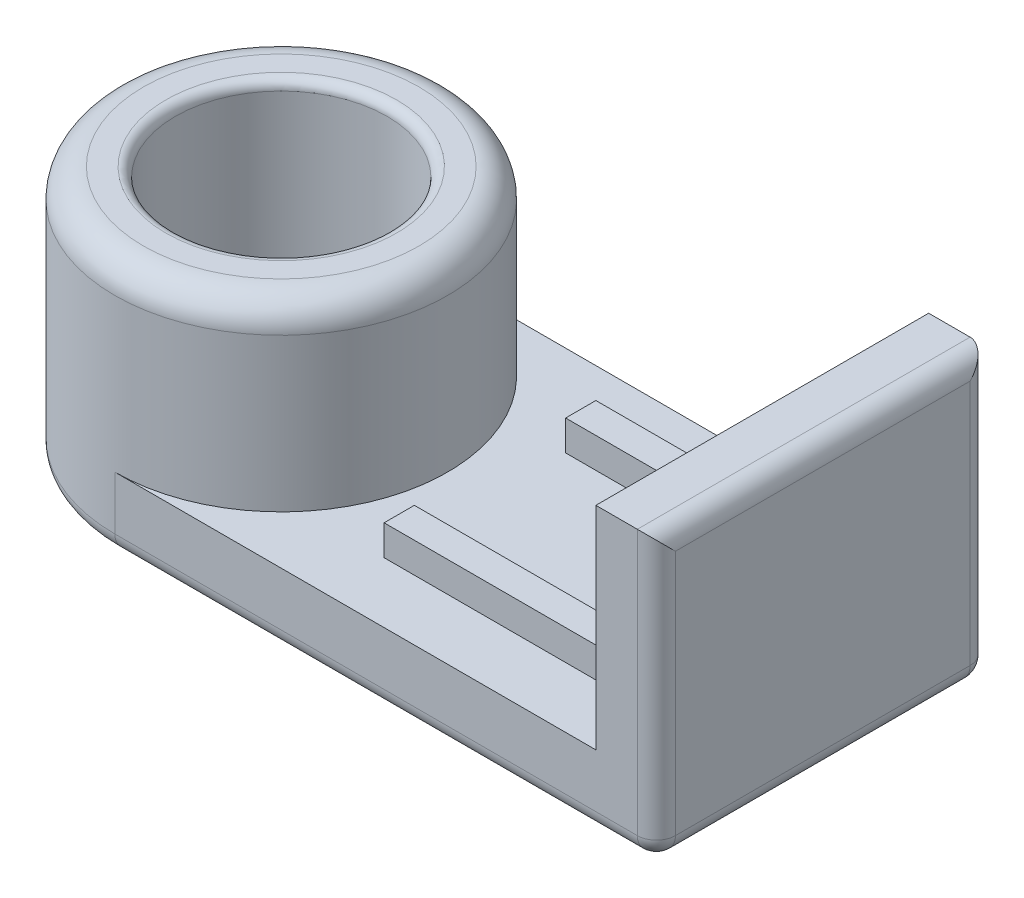
from build123d import *

# Parameters (mm, degrees)
BOSS_EXTRUDE1_DEPTH = 7.62
SKETCH4_W           = 6.35
SKETCH4_H           = 34.925
BOSS_EXTRUDE3_DEPTH = 12.7
SKETCH5_R           = 11.1125
CUT_EXTRUDE1_DEPTH  = 12.7
SKETCH6_W           = 25.4
SKETCH6_H           = 3.175
BOSS_EXTRUDE4_DEPTH = 3.175
SKETCH7_W           = 25.4
SKETCH7_H           = 3.175
BOSS_EXTRUDE5_DEPTH = 3.175
SKETCH10_W          = 6.35
SKETCH10_H          = 34.925
BOSS_EXTRUDE8_DEPTH = 9.525
FILLET1_R           = 2
FILLET2_R           = 2
SKETCH11_R          = 17.4625
BOSS_EXTRUDE9_DEPTH = 19.05
SKETCH12_R          = 11.1125
CUT_EXTRUDE2_DEPTH  = 47.677899348
FILLET3_R           = 1
FILLET4_R           = 3


with BuildPart() as part:
    # Sketch1 → Boss-Extrude1 (new body)
    with BuildSketch(Plane(origin=(0, 0, 0), x_dir=(1, 0, 0), z_dir=(0, 1, 0))):
        with BuildLine():
            Line((37.1475, -17.4625), (37.1475, 17.4625))
            Line((37.1475, 17.4625), (-19.685, 17.4625))
            ThreePointArc((-19.685, 17.4625), (-37.1475, 0), (-19.685, -17.4625))
            Line((-19.685, -17.4625), (37.1475, -17.4625))
        make_face()
    extrude(amount=BOSS_EXTRUDE1_DEPTH)

    # Sketch4 → Boss-Extrude3 (add)
    with BuildSketch(Plane(origin=(0, 7.62, 0), x_dir=(1, 0, 0), z_dir=(0, 1, 0))):
        with Locations((33.9725, 0)):
            Rectangle(SKETCH4_W, SKETCH4_H)
    extrude(amount=BOSS_EXTRUDE3_DEPTH)

    # Sketch5 → Cut-Extrude1 (cut)
    with BuildSketch(Plane(origin=(0, 7.62, 0), x_dir=(1, 0, 0), z_dir=(0, 1, 0))):
        with Locations((-19.685, 0)):
            Circle(SKETCH5_R)
    extrude(amount=-CUT_EXTRUDE1_DEPTH, mode=Mode.SUBTRACT)

    # Sketch6 → Boss-Extrude4 (add)
    with BuildSketch(Plane(origin=(0, 7.62, 0), x_dir=(1, 0, 0), z_dir=(0, 1, 0))):
        with Locations((14.9225, 9.525)):
            Rectangle(SKETCH6_W, SKETCH6_H)
    extrude(amount=BOSS_EXTRUDE4_DEPTH)

    # Sketch7 → Boss-Extrude5 (add)
    with BuildSketch(Plane(origin=(0, 7.62, 0), x_dir=(1, 0, 0), z_dir=(0, 1, 0))):
        with Locations((14.9225, -9.525)):
            Rectangle(SKETCH7_W, SKETCH7_H)
    extrude(amount=BOSS_EXTRUDE5_DEPTH)

    # Sketch10 → Boss-Extrude8 (add)
    with BuildSketch(Plane(origin=(0, 20.32, 0), x_dir=(1, 0, 0), z_dir=(0, 1, 0))):
        with Locations((33.9725, 0)):
            Rectangle(SKETCH10_W, SKETCH10_H)
    extrude(amount=BOSS_EXTRUDE8_DEPTH)

    # Fillet1
    fillet1_edges = [part.edges().sort_by_distance(p)[0] for p in [
        (37.1475, 14.9225, 17.4625),
        (37.1475, 14.9225, -17.4625),
        (37.1475, 29.845, 0),
    ]]
    fillet(fillet1_edges, radius=FILLET1_R)

    # Fillet2
    fillet2_edges = [part.edges().sort_by_distance(p)[0] for p in [
        (36.561713562, 0, -16.876713562),
        (37.1475, 0, 0),
        (36.561713562, 0, 16.876713562),
        (7.73125, 0, 17.4625),
        (-37.1475, 0, 0),
        (7.73125, 0, -17.4625),
    ]]
    fillet(fillet2_edges, radius=FILLET2_R)

    # Sketch11 → Boss-Extrude9 (add)
    with BuildSketch(Plane(origin=(0, 7.62, 0), x_dir=(1, 0, 0), z_dir=(0, 1, 0))):
        with Locations((-19.685, 0)):
            Circle(SKETCH11_R)
    extrude(amount=BOSS_EXTRUDE9_DEPTH)

    # Sketch12 → Cut-Extrude2 (cut, through all)
    with BuildSketch(Plane(origin=(0, 7.62, 0), x_dir=(-1, 0, 0), z_dir=(0, -1, 0))):
        with Locations((19.685, 0)):
            Circle(SKETCH12_R)
    extrude(amount=-CUT_EXTRUDE2_DEPTH, mode=Mode.SUBTRACT)

    # Fillet3
    fillet3_edges = [part.edges().sort_by_distance(p)[0] for p in [
        (-8.5725, 26.67, 0),
        (-30.7975, 0, 0),
    ]]
    fillet(fillet3_edges, radius=FILLET3_R)

    # Fillet4
    fillet4_edges = [part.edges().sort_by_distance(p)[0] for p in [
        (-37.1475, 26.67, 0),
    ]]
    fillet(fillet4_edges, radius=FILLET4_R)


solid = part.part
